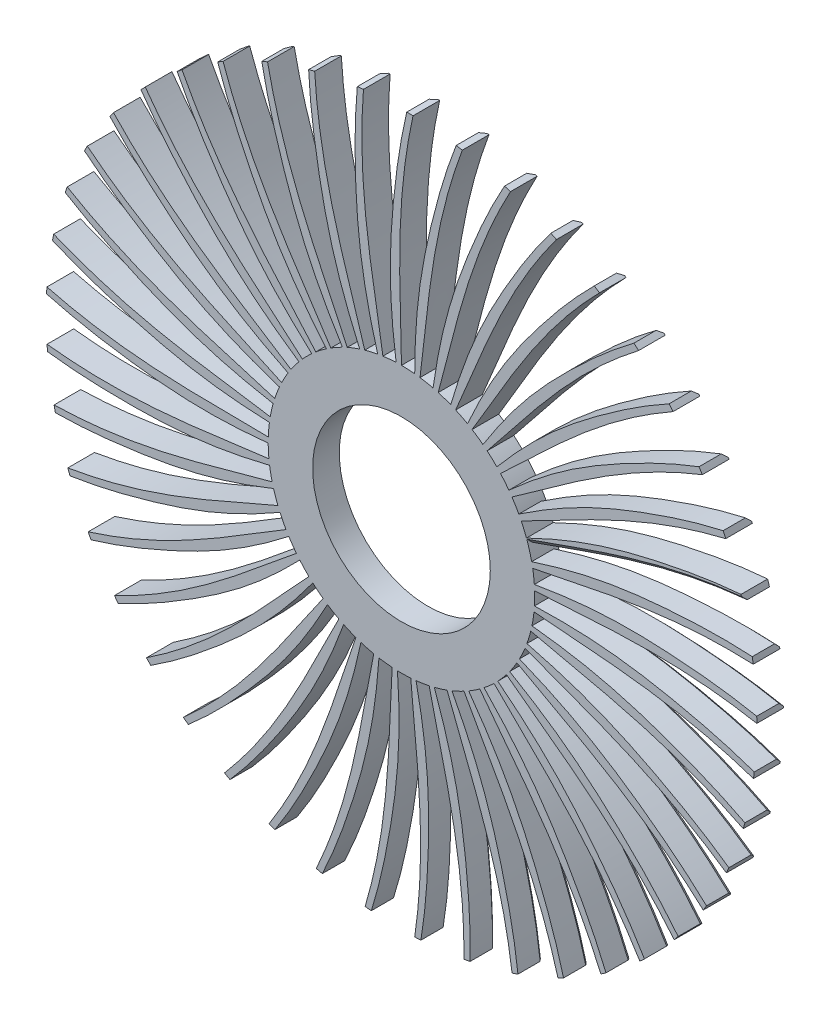
from build123d import *

# Parameters (mm, degrees)
BOSS_EXTRUDE1_DEPTH = 30
CHAMFER1_SIZE       = 5
SKETCH4_R           = 100
CUT_EXTRUDE4_DEPTH  = 30


with BuildPart() as part:
    # Sketch2 → Boss-Extrude1 (new body)
    with BuildSketch(Plane.XY):
        with BuildLine():
            ThreePointArc((13, 399.788694187), (9.500363898, 399.887162942), (6, 399.954997468))
            add(Edge.make_bspline(
                [(-6, 149.879951962), (-14.222349113, 209.385782), (-13.846043503, 280.401880418), (-1.519632424, 368.635153741), (6, 399.954997468)],
                knots=[0, 0, 0, 0, 0.599000586, 1, 1, 1, 1], degree=3))
            ThreePointArc((-6, 149.879951962), (-13.454668429, 149.395354337), (-20.875965144, 148.540210311))
            add(Edge.make_bspline(
                [(-20.875965144, 148.540210311), (-34.199051212, 230.939945753), (-50.019130887, 303.55711138), (-42.766347406, 397.70722841)],
                knots=[0, 0, 0, 0, 1, 1, 1, 1], degree=3))
            ThreePointArc((-42.766347406, 397.70722841), (-46.245629492, 397.317683665), (-49.72136883, 396.897701532))
            add(Edge.make_bspline(
                [(-26.800866099, 147.586291966), (-43.224806767, 205.368685534), (-52.735693973, 275.746031783), (-52.808940935, 364.836129809), (-49.72136883, 396.897701532)],
                knots=[0, 0, 0, 0, 0.599000586, 1, 1, 1, 1], degree=3))
            ThreePointArc((-26.800866099, 147.586291966), (-34.115543253, 146.068921091), (-41.345603373, 144.189254391))
            add(Edge.make_bspline(
                [(-41.345603373, 144.189254391), (-66.006856782, 223.932866069), (-91.779332653, 293.641596886), (-97.700296505, 387.884843817)],
                knots=[0, 0, 0, 0, 1, 1, 1, 1], degree=3))
            ThreePointArc((-97.700296505, 387.884843817), (-101.091504306, 387.014867618), (-104.474967773, 386.1152433))
            add(Edge.make_bspline(
                [(-47.080083824, 142.420032675), (-71.385942725, 197.354321208), (-90.598904145, 265.723100296), (-103.07038348, 353.935985605), (-104.474967773, 386.1152433)],
                knots=[0, 0, 0, 0, 0.599000586, 1, 1, 1, 1], degree=3))
            ThreePointArc((-47.080083824, 142.420032675), (-54.112397833, 139.899422446), (-61.010496461, 137.031818646))
            add(Edge.make_bspline(
                [(-61.010496461, 137.031818646), (-96.529913967, 212.567187867), (-131.753154106, 278.010682721), (-150.732620465, 370.512721951)],
                knots=[0, 0, 0, 0, 1, 1, 1, 1], degree=3))
            ThreePointArc((-150.732620465, 370.512721951), (-153.96974798, 369.179247395), (-157.195080306, 367.817491057))
            add(Edge.make_bspline(
                [(-66.442941271, 134.481729448), (-98.157632508, 185.498679506), (-126.698709702, 250.528170916), (-151.325678251, 336.146880037), (-157.195080306, 367.817491057)],
                knots=[0, 0, 0, 0, 0.599000586, 1, 1, 1, 1], degree=3))
            ThreePointArc((-66.442941271, 134.481729448), (-73.056016141, 131.006940677), (-79.487889635, 127.207214423))
            add(Edge.make_bspline(
                [(-79.487889635, 127.207214423), (-125.174126178, 197.064131145), (-169.162550282, 256.968606849), (-200.831105423, 345.928991405)],
                knots=[0, 0, 0, 0, 1, 1, 1, 1], degree=3))
            ThreePointArc((-200.831105423, 345.928991405), (-203.851145646, 344.157973057), (-206.855569408, 342.360589736))
            add(Edge.make_bspline(
                [(-84.512562444, 123.925892328), (-123.018795627, 170.03251701), (-160.332468993, 230.456995662), (-196.635590825, 311.815057811), (-206.855569408, 342.360589736)],
                knots=[0, 0, 0, 0, 0.599000586, 1, 1, 1, 1], degree=3))
            ThreePointArc((-84.512562444, 123.925892328), (-90.577682196, 119.564557826), (-96.418141453, 114.906666468))
            add(Edge.make_bspline(
                [(-96.418141453, 114.906666468), (-151.381966406, 177.725445267), (-203.279389835, 230.924929343), (-247.020641356, 314.61214653)],
                knots=[0, 0, 0, 0, 1, 1, 1, 1], degree=3))
            ThreePointArc((-247.020641356, 314.61214653), (-249.764812641, 312.438055247), (-252.489850147, 310.240028966))
            add(Edge.make_bspline(
                [(-100.93724272, 110.957978677), (-145.48553782, 151.256864979), (-190.845539151, 205.900237127), (-238.118215294, 281.414110168), (-252.489850147, 310.240028966)],
                knots=[0, 0, 0, 0, 0.599000586, 1, 1, 1, 1], degree=3))
            ThreePointArc((-100.93724272, 110.957978677), (-106.336356696, 105.794986859), (-111.471723822, 100.369590954))
            add(Edge.make_bspline(
                [(-111.471723822, 100.369590954), (-174.643328852, 154.927535756), (-233.439627293, 200.38656076), (-288.402201487, 277.171734088)],
                knots=[0, 0, 0, 0, 1, 1, 1, 1], degree=3))
            ThreePointArc((-288.402201487, 277.171734088), (-290.81709166, 274.636886085), (-293.209703155, 272.080998925))
            add(Edge.make_bspline(
                [(-115.397294381, 95.830394184), (-165.120569508, 129.537170123), (-217.644017972, 177.335864686), (-274.966139557, 245.535756975), (-293.209703155, 272.080998925)],
                knots=[0, 0, 0, 0, 0.599000586, 1, 1, 1, 1], degree=3))
            ThreePointArc((-115.397294381, 95.830394184), (-120.02531497, 89.966236813), (-124.355635883, 83.878935521))
            add(Edge.make_bspline(
                [(-124.355635883, 83.878935521), (-194.505457557, 129.11413799), (-259.056227939, 165.947895708), (-324.170340819, 234.33648912)],
                knots=[0, 0, 0, 0, 1, 1, 1, 1], degree=3))
            ThreePointArc((-324.170340819, 234.33648912), (-326.208946789, 231.49022233), (-328.222562812, 228.626221727))
            add(Edge.make_bspline(
                [(-127.61126897, 78.837580074), (-181.541717132, 105.296181597), (-240.20630355, 145.319851354), (-306.462160683, 204.878329566), (-328.222562812, 228.626221727)],
                knots=[0, 0, 0, 0, 0.599000586, 1, 1, 1, 1], degree=3))
            ThreePointArc((-127.61126897, 78.837580074), (-131.378117014, 72.386396303), (-134.819106945, 65.755672018))
            add(Edge.make_bspline(
                [(-134.819106945, 65.755672018), (-210.581758776, 100.787680393), (-279.63059378, 128.27924363), (-353.628873205, 186.940150946)],
                knots=[0, 0, 0, 0, 1, 1, 1, 1], degree=3))
            ThreePointArc((-353.628873205, 186.940150946), (-355.251515827, 183.837864714), (-356.846943632, 180.721495182))
            add(Edge.make_bspline(
                [(-137.341435363, 60.310282144), (-194.429361732, 79.00572267), (-258.09324666, 110.475352415), (-331.993244448, 160.233178517), (-356.846943632, 180.721495182)],
                knots=[0, 0, 0, 0, 0.599000586, 1, 1, 1, 1], degree=3))
            ThreePointArc((-137.341435363, 60.310282144), (-140.173793452, 53.397636927), (-142.658477444, 46.352549156))
            add(Edge.make_bspline(
                [(-142.658477444, 46.352549156), (-222.559325594, 70.499505241), (-294.762268188, 88.113781989), (-376.204421821, 135.905235374)],
                knots=[0, 0, 0, 0, 1, 1, 1, 1], degree=3))
            ThreePointArc((-376.204421821, 135.905235374), (-377.379518202, 132.607312173), (-378.525704601, 129.2992303))
            add(Edge.make_bspline(
                [(-144.398406941, 40.609113174), (-203.532659967, 51.177507218), (-270.956698301, 73.480576405), (-351.062457345, 112.469270911), (-378.525704601, 129.2992303)],
                knots=[0, 0, 0, 0, 0.599000586, 1, 1, 1, 1], degree=3))
            ThreePointArc((-144.398406941, 40.609113174), (-146.241146445, 33.369553287), (-147.721162952, 26.04722665))
            add(Edge.make_bspline(
                [(-147.721162952, 26.04722665), (-230.205028297, 38.839137412), (-304.156730333, 46.23328581), (-391.457579293, 82.225078986)],
                knots=[0, 0, 0, 0, 1, 1, 1, 1], degree=3))
            ThreePointArc((-391.457579293, 82.225078986), (-392.162257517, 78.79570914), (-392.836893297, 75.360302977))
            add(Edge.make_bspline(
                [(-148.644827779, 20.117534009), (-208.67442649, 22.353179801), (-278.546286018, 35.055584558), (-363.298638838, 62.516276878), (-392.836893297, 75.360302977)],
                knots=[0, 0, 0, 0, 0.599000586, 1, 1, 1, 1], degree=3))
            ThreePointArc((-148.644827779, 20.117534009), (-149.462081869, 12.69196925), (-149.908624053, 5.234924505))
            add(Edge.make_bspline(
                [(-149.908624053, 5.234924505), (-233.370051979, 6.422809952), (-307.631127696, 3.452911312), (-399.09146026, 26.944504965)],
                knots=[0, 0, 0, 0, 1, 1, 1, 1], degree=3))
            ThreePointArc((-399.09146026, 26.944504965), (-399.312004568, 23.450437257), (-399.50195871, 19.954573077))
            add(Edge.make_bspline(
                [(-149.998046125, -0.765610073), (-209.754582665, -6.906226834), (-280.714287119, -4.051724367), (-368.463625573, 11.346474627), (-399.50195871, 19.954573077)],
                knots=[0, 0, 0, 0, 0.599000586, 1, 1, 1, 1], degree=3))
            ThreePointArc((-149.998046125, -0.765610073), (-149.77390788, -8.232649532), (-149.178284305, -15.67926949))
            add(Edge.make_bspline(
                [(-149.178284305, -15.67926949), (-231.992793053, -26.118530198), (-305.117835083, -39.394670176), (-398.957479912, -28.860513196)],
                knots=[0, 0, 0, 0, 1, 1, 1, 1], degree=3))
            ThreePointArc((-398.957479912, -28.860513196), (-398.689597661, -32.351270713), (-398.391172924, -35.83954989))
            add(Edge.make_bspline(
                [(-148.431723123, -21.633852425), (-206.752104481, -36.031211619), (-277.418503929, -43.080171086), (-366.456886956, -40.044173846), (-398.391172924, -35.83954989)],
                knots=[0, 0, 0, 0, 0.599000586, 1, 1, 1, 1], degree=3))
            ThreePointArc((-148.431723123, -21.633852425), (-147.17055514, -28.997029155), (-145.544358941, -36.28828434))
            add(Edge.make_bspline(
                [(-145.544358941, -36.28828434), (-226.100058298, -58.151502867), (-296.665770876, -81.475479221), (-391.058246026, -84.103794296)],
                knots=[0, 0, 0, 0, 1, 1, 1, 1], degree=3))
            ThreePointArc((-391.058246026, -84.103794296), (-390.307151238, -87.523297997), (-389.52615612, -90.936096785))
            add(Edge.make_bspline(
                [(-143.976345469, -42.081016449), (-199.72543176, -64.454889855), (-268.723085119, -81.270111278), (-357.317481874, -90.655408024), (-389.52615612, -90.936096785)],
                knots=[0, 0, 0, 0, 0.599000586, 1, 1, 1, 1], degree=3))
            ThreePointArc((-143.976345469, -42.081016449), (-141.702694948, -49.19701459), (-139.077578185, -56.190989012))
            add(Edge.make_bspline(
                [(-139.077578185, -56.190989012), (-215.806543094, -89.05262268), (-282.439444892, -121.97046074), (-375.547508203, -137.710090707)],
                knots=[0, 0, 0, 0, 1, 1, 1, 1], degree=3))
            ThreePointArc((-375.547508203, -137.710090707), (-374.327820084, -140.991783842), (-373.079455766, -144.262675994))
            add(Edge.make_bspline(
                [(-136.718632022, -61.709121353), (-188.811330695, -91.624026976), (-254.797277125, -117.878221197), (-341.223298449, -139.502137805), (-373.079455766, -144.262675994)],
                knots=[0, 0, 0, 0, 0.599000586, 1, 1, 1, 1], degree=3))
            ThreePointArc((-136.718632022, -61.709121353), (-133.476752983, -68.439436096), (-129.903810568, -75))
            add(Edge.make_bspline(
                [(-129.903810568, -75), (-201.312599004, -118.220434487), (-262.715756383, -160.091425979), (-352.727165312, -188.636016845)],
                knots=[0, 0, 0, 0, 1, 1, 1, 1], degree=3))
            ThreePointArc((-352.727165312, -188.636016845), (-351.062623704, -191.71602499), (-349.371188178, -194.781346312))
            add(Edge.make_bspline(
                [(-126.799845917, -80.136128403), (-174.222231847, -117.009806633), (-235.91212996, -152.191965625), (-318.487591656, -185.633617154), (-349.371188178, -194.781346312)],
                knots=[0, 0, 0, 0, 0.599000586, 1, 1, 1, 1], degree=3))
            ThreePointArc((-126.799845917, -80.136128403), (-122.652837849, -86.349761827), (-118.201613041, -92.349221299))
            add(Edge.make_bspline(
                [(-118.201613041, -92.349221299), (-182.900334165, -145.087220011), (-237.878604511, -195.096393713), (-323.041389369, -235.890357485)],
                knots=[0, 0, 0, 0, 1, 1, 1, 1], degree=3))
            ThreePointArc((-323.041389369, -235.890357485), (-320.964392681, -238.708731786), (-318.862807816, -241.508819284))
            add(Edge.make_bspline(
                [(-114.413045044, -97.003376868), (-156.242095431, -140.118123501), (-212.435221531, -183.543466558), (-289.552886165, -228.151949301), (-318.862807816, -241.508819284)],
                knots=[0, 0, 0, 0, 0.599000586, 1, 1, 1, 1], degree=3))
            ThreePointArc((-114.413045044, -97.003376868), (-109.441624742, -102.579387666), (-104.198755569, -107.900970051))
            add(Edge.make_bspline(
                [(-104.198755569, -107.900970051), (-160.928122367, -169.130047832), (-208.411416185, -226.304032063), (-287.067980236, -278.553360639)],
                knots=[0, 0, 0, 0, 1, 1, 1, 1], degree=3))
            ThreePointArc((-287.067980236, -278.553360639), (-284.618954846, -281.055244645), (-282.1481256, -283.535597801))
            add(Edge.make_bspline(
                [(-99.799324392, -111.982564942), (-135.22088435, -160.499200477), (-184.823503156, -211.322502692), (-254.982363107, -266.229563273), (-282.1481256, -283.535597801)],
                knots=[0, 0, 0, 0, 0.599000586, 1, 1, 1, 1], degree=3))
            ThreePointArc((-99.799324392, -111.982564942), (-94.100254897, -116.812422406), (-88.167787844, -121.352549156))
            add(Edge.make_bspline(
                [(-88.167787844, -121.352549156), (-135.82362772, -189.880951654), (-174.887736707, -253.106919845), (-245.507119403, -315.794639477)],
                knots=[0, 0, 0, 0, 1, 1, 1, 1], degree=3))
            ThreePointArc((-245.507119403, -315.794639477), (-242.733732804, -317.931336862), (-239.941751059, -320.043678424))
            add(Edge.make_bspline(
                [(-83.243123411, -124.782139767), (-111.567752567, -177.75634308), (-153.614405526, -234.988386687), (-215.448898389, -299.125321628), (-239.941751059, -320.043678424)],
                knots=[0, 0, 0, 0, 0.599000586, 1, 1, 1, 1], degree=3))
            ThreePointArc((-83.243123411, -124.782139767), (-76.927330628, -128.771836216), (-70.420734418, -132.442138929))
            add(Edge.make_bspline(
                [(-70.420734418, -132.442138929), (-108.075480657, -206.936038739), (-137.960066366, -274.983369337), (-199.167741751, -346.889334869)],
                knots=[0, 0, 0, 0, 1, 1, 1, 1], degree=3))
            ThreePointArc((-199.167741751, -346.889334869), (-196.123974759, -348.619257249), (-193.065183262, -350.32247289))
            add(Edge.make_bspline(
                [(-65.066689721, -135.152972179), (-85.743081387, -191.55366066), (-119.415378226, -254.080489031), (-171.721965934, -326.198945848), (-193.065183262, -350.32247289)],
                knots=[0, 0, 0, 0, 0.599000586, 1, 1, 1, 1], degree=3))
            ThreePointArc((-65.066689721, -135.152972179), (-58.257103372, -138.22485271), (-51.303021499, -140.953893118))
            add(Edge.make_bspline(
                [(-51.303021499, -140.953893118), (-78.223767297, -219.963351216), (-98.347160261, -291.507580335), (-148.951790556, -371.232223938)],
                knots=[0, 0, 0, 0, 1, 1, 1, 1], degree=3))
            ThreePointArc((-148.951790556, -371.232223938), (-145.696886633, -372.521700342), (-142.430821282, -373.782638908))
            add(Edge.make_bspline(
                [(-45.623806927, -142.893205722), (-58.249518658, -201.622604125), (-82.892066422, -268.227203667), (-124.652660742, -346.923478632), (-142.430821282, -373.782638908)],
                knots=[0, 0, 0, 0, 0.599000586, 1, 1, 1, 1], degree=3))
            ThreePointArc((-45.623806927, -142.893205722), (-38.452967865, -144.987479675), (-31.186753623, -146.72214011))
            add(Edge.make_bspline(
                [(-31.186753623, -146.72214011), (-46.849517285, -228.709327266), (-56.820038549, -302.357927866), (-95.836662188, -388.349500039)],
                knots=[0, 0, 0, 0, 1, 1, 1, 1], degree=3))
            ThreePointArc((-95.836662188, -388.349500039), (-92.433974336, -389.173432275), (-89.024205379, -389.96755103))
            add(Edge.make_bspline(
                [(-25.292908628, -147.852185554), (-29.622195307, -207.767192943), (-44.755354834, -277.153180889), (-75.1571333, -360.895540525), (-89.024205379, -389.96755103)],
                knots=[0, 0, 0, 0, 0.599000586, 1, 1, 1, 1], degree=3))
            ThreePointArc((-25.292908628, -147.852185554), (-17.900389078, -148.928090268), (-10.463471062, -149.634607539))
            add(Edge.make_bspline(
                [(-10.463471062, -149.634607539), (-14.563394709, -233.003736414), (-14.186979419, -307.323222258), (-40.856182202, -397.907994863)],
                knots=[0, 0, 0, 0, 1, 1, 1, 1], degree=3))
            ThreePointArc((-40.856182202, -397.907994863), (-37.371939871, -398.250346027), (-33.884834581, -398.562188354))
            add(Edge.make_bspline(
                [(-4.469712632, -149.933390774), (-0.418309619, -209.867829681), (-5.747531172, -280.684686701), (-24.198757747, -367.843181234), (-33.884834581, -398.562188354)],
                knots=[0, 0, 0, 0, 0.599000586, 1, 1, 1, 1], degree=3))
            ThreePointArc((-4.469712632, -149.933390774), (3.00060042, -149.969984987), (10.463471062, -149.634607539))
            add(Edge.make_bspline(
                [(10.463471062, -149.634607539), (18.006187779, -232.76299287), (28.722213128, -306.306819704), (14.919516896, -399.72166318)],
                knots=[0, 0, 0, 0, 1, 1, 1, 1], degree=3))
            ThreePointArc((14.919516896, -399.72166318), (18.417496894, -399.575769796), (21.914065978, -399.399266039))
            add(Edge.make_bspline(
                [(16.440481235, -149.096313089), (28.79371799, -207.883627836), (33.372161647, -278.752984361), (27.230619099, -367.631172835), (21.914065978, -399.399266039)],
                knots=[0, 0, 0, 0, 0.599000586, 1, 1, 1, 1], degree=3))
            ThreePointArc((16.440481235, -149.096313089), (23.843186645, -148.092884537), (31.186753623, -146.72214011))
            add(Edge.make_bspline(
                [(31.186753623, -146.72214011), (50.225300304, -227.991782434), (71.072360468, -299.328503323), (70.404824569, -393.755204)],
                knots=[0, 0, 0, 0, 1, 1, 1, 1], degree=3))
            ThreePointArc((70.404824569, -393.755204), (73.848458031, -393.123905717), (77.286434171, -392.46249132))
            add(Edge.make_bspline(
                [(37.030679836, -145.357245264), (57.445308631, -201.85320764), (71.842303299, -271.395672257), (78.129982919, -360.263641831), (77.286434171, -392.46249132)],
                knots=[0, 0, 0, 0, 0.599000586, 1, 1, 1, 1], degree=3))
            ThreePointArc((37.030679836, -145.357245264), (44.221692363, -143.333324543), (51.303021499, -140.953893118))
            add(Edge.make_bspline(
                [(51.303021499, -140.953893118), (81.466834489, -218.78297129), (112.039165155, -286.524098106), (124.519782416, -380.124747665)],
                knots=[0, 0, 0, 0, 1, 1, 1, 1], degree=3))
            ThreePointArc((124.519782416, -380.124747665), (127.842042934, -379.020331986), (131.154509834, -377.886880627))
            add(Edge.make_bspline(
                [(56.900118376, -138.788964002), (84.978791682, -191.893944361), (108.914116237, -258.7559521), (127.508635493, -345.883988833), (131.154509834, -377.886880627)],
                knots=[0, 0, 0, 0, 0.599000586, 1, 1, 1, 1], degree=3))
            ThreePointArc((56.900118376, -138.788964002), (63.73947314, -135.783944426), (70.420734418, -132.442138929))
            add(Edge.make_bspline(
                [(70.420734418, -132.442138929), (111.122709408, -205.315798472), (150.825254934, -268.142827236), (176.211104337, -359.095595501)],
                knots=[0, 0, 0, 0, 1, 1, 1, 1], degree=3))
            ThreePointArc((176.211104337, -359.095595501), (179.34732789, -357.539558621), (182.469812149, -355.956131643))
            add(Edge.make_bspline(
                [(75.662060835, -129.519313426), (110.858259215, -178.199683731), (143.86603979, -241.079841667), (174.405477516, -324.77209743), (182.469812149, -355.956131643)],
                knots=[0, 0, 0, 0, 0.599000586, 1, 1, 1, 1], degree=3))
            ThreePointArc((75.662060835, -129.519313426), (82.016637575, -125.591684282), (88.167787844, -121.352549156))
            add(Edge.make_bspline(
                [(88.167787844, -121.352549156), (138.615707188, -187.852387179), (186.675702688, -244.542461241), (224.47267755, -331.077056036)],
                knots=[0, 0, 0, 0, 1, 1, 1, 1], degree=3))
            ThreePointArc((224.47267755, -331.077056036), (227.361821112, -329.099684443), (230.233547127, -327.097101451))
            add(Edge.make_bspline(
                [(92.951327344, -117.728716739), (134.579996832, -161.036968957), (176.017774524, -218.711386339), (217.907715302, -297.338886573), (230.233547127, -327.097101451)],
                knots=[0, 0, 0, 0, 0.599000586, 1, 1, 1, 1], degree=3))
            ThreePointArc((92.951327344, -117.728716739), (98.697441453, -112.954924862), (104.198755569, -107.900970051))
            add(Edge.make_bspline(
                [(104.198755569, -107.900970051), (163.410707901, -166.73264285), (218.892720229, -216.182354402), (268.365145428, -296.61447827)],
                knots=[0, 0, 0, 0, 1, 1, 1, 1], degree=3))
            ThreePointArc((268.365145428, -296.61447827), (270.950975107, -294.254259253), (273.516047997, -291.871498246))
            add(Edge.make_bspline(
                [(108.431401996, -103.646664496), (155.682287893, -140.739852759), (204.743523494, -192.085962657), (257.168627276, -264.118312507), (273.516047997, -291.871498246)],
                knots=[0, 0, 0, 0, 0.599000586, 1, 1, 1, 1], degree=3))
            ThreePointArc((108.431401996, -103.646664496), (113.457211899, -98.119626314), (118.201613041, -92.349221299))
            add(Edge.make_bspline(
                [(118.201613041, -92.349221299), (185.025105061, -142.367637282), (246.849239958, -183.614503938), (307.034191011, -256.378637079)],
                knots=[0, 0, 0, 0, 1, 1, 1, 1], degree=3))
            ThreePointArc((307.034191011, -256.378637079), (309.266376574, -253.681509615), (311.474870112, -250.964948327))
            add(Edge.make_bspline(
                [(121.800982748, -87.547247825), (173.754400306, -117.703395416), (229.484172672, -161.721804207), (291.424044446, -225.756975918), (311.474870112, -250.964948327)],
                knots=[0, 0, 0, 0, 0.599000586, 1, 1, 1, 1], degree=3))
            ThreePointArc((121.800982748, -87.547247825), (126.008666771, -81.37454085), (129.903810568, -75))
            add(Edge.make_bspline(
                [(129.903810568, -75), (203.038199014, -115.231607596), (270.001120017, -147.472806013), (339.727165312, -211.152677343)],
                knots=[0, 0, 0, 0, 1, 1, 1, 1], degree=3))
            ThreePointArc((339.727165312, -211.152677343), (341.562259806, -208.171137952), (343.371188178, -205.173651157))
            add(Edge.make_bspline(
                [(132.799845917, -69.743823558), (188.44458096, -92.375975367), (249.758173463, -128.209914793), (320.00722408, -183.001536587), (343.371188178, -205.173651157)],
                knots=[0, 0, 0, 0, 0.599000586, 1, 1, 1, 1], degree=3))
            ThreePointArc((132.799845917, -69.743823558), (136.107506278, -63.04559251), (139.077578185, -56.190989012))
            add(Edge.make_bspline(
                [(139.077578185, -56.190989012), (217.099385377, -85.852725742), (287.897735398, -108.460717667), (365.807736774, -161.816870925)],
                knots=[0, 0, 0, 0, 1, 1, 1, 1], degree=3))
            ThreePointArc((365.807736774, -161.816870925), (367.210022172, -158.608951879), (368.584176646, -155.388882249))
            add(Edge.make_bspline(
                [(141.213911143, -50.582915098), (199.466902198, -65.250562033), (265.170915503, -92.202565225), (342.3618271, -136.684180508), (368.584176646, -155.388882249)],
                knots=[0, 0, 0, 0, 0.599000586, 1, 1, 1, 1], degree=3))
            ThreePointArc((141.213911143, -50.582915098), (143.557167994, -43.489533425), (145.544358941, -36.28828434))
            add(Edge.make_bspline(
                [(145.544358941, -36.28828434), (226.934979149, -54.802818237), (300.190748837, -67.337564823), (384.768276741, -109.331483179)],
                knots=[0, 0, 0, 0, 1, 1, 1, 1], degree=3))
            ThreePointArc((384.768276741, -109.331483179), (385.710459152, -105.959622973), (386.623093373, -102.5796455))
            add(Edge.make_bspline(
                [(146.879408216, -30.437467733), (206.606827075, -36.855120731), (275.422407301, -54.400597603), (358.052746587, -87.706422331), (386.623093373, -102.5796455)],
                knots=[0, 0, 0, 0, 0.599000586, 1, 1, 1, 1], degree=3))
            ThreePointArc((146.879408216, -30.437467733), (148.21265273, -23.08700004), (149.178284305, -15.67926949))
            add(Edge.make_bspline(
                [(149.178284305, -15.67926949), (232.353541687, -22.686236213), (306.640890813, -24.903762876), (396.239739868, -54.718082475)],
                knots=[0, 0, 0, 0, 1, 1, 1, 1], degree=3))
            ThreePointArc((396.239739868, -54.718082475), (396.703480784, -51.247910533), (397.136831365, -47.773812634))
            add(Edge.make_bspline(
                [(149.686064682, -9.699589681), (209.725385075, -7.742336426), (280.313115228, -15.539784229), (366.77457664, -37.021558408), (397.136831365, -47.773812634)],
                knots=[0, 0, 0, 0, 0.599000586, 1, 1, 1, 1], degree=3))
            ThreePointArc((149.686064682, -9.699589681), (149.983346769, -2.235104461), (149.908624053, 5.234924505))
            add(Edge.make_bspline(
                [(149.908624053, 5.234924505), (233.249606835, 9.871907594), (307.122616647, 18.014762488), (399.998847174, 0.960343463)],
                knots=[0, 0, 0, 0, 1, 1, 1, 1], degree=3))
            ThreePointArc((399.998847174, 0.960343463), (399.975120405, 4.461284192), (399.920752671, 7.961883153))
            add(Edge.make_bspline(
                [(149.579252164, 11.227079851), (208.761877013, 21.521143651), (279.74784722, 23.623493369), (368.357556759, 14.383888037), (399.920752671, 7.961883153)],
                knots=[0, 0, 0, 0, 0.599000586, 1, 1, 1, 1], degree=3))
            ThreePointArc((149.579252164, 11.227079851), (148.834785567, 18.660294884), (147.721162952, 26.04722665))
            add(Edge.make_bspline(
                [(147.721162952, 26.04722665), (229.605733703, 42.237905949), (301.626550096, 60.582650991), (395.972431912, 56.620077408)],
                knots=[0, 0, 0, 0, 1, 1, 1, 1], degree=3))
            ThreePointArc((395.972431912, 56.620077408), (395.461699273, 60.083645094), (394.920671429, 63.542609941))
            add(Edge.make_bspline(
                [(146.561049647, 31.935227045), (203.735056479, 50.365739146), (273.737605573, 62.32696654), (362.770876036, 65.509368464), (394.920671429, 63.542609941)],
                knots=[0, 0, 0, 0, 0.599000586, 1, 1, 1, 1], degree=3))
            ThreePointArc((146.561049647, 31.935227045), (144.789324561, 39.192492815), (142.658477444, 46.352549156))
            add(Edge.make_bspline(
                [(142.658477444, 46.352549156), (221.492846137, 73.781791509), (290.259665842, 101.971367105), (384.238863675, 111.177765951)],
                knots=[0, 0, 0, 0, 1, 1, 1, 1], degree=3))
            ThreePointArc((384.238863675, 111.177765951), (383.251065996, 114.536546189), (382.233908533, 117.886552105))
            add(Edge.make_bspline(
                [(140.690203009, 52.02179137), (194.742764815, 78.230022819), (262.399372806, 99.817316203), (350.123272857, 115.359783549), (382.233908533, 117.886552105)],
                knots=[0, 0, 0, 0, 0.599000586, 1, 1, 1, 1], degree=3))
            ThreePointArc((140.690203009, 52.02179137), (137.925704048, 58.961853455), (134.819106945, 65.755672018))
            add(Edge.make_bspline(
                [(134.819106945, 65.755672018), (209.068852265, 103.889598424), (273.243207358, 141.375326549), (365.026523021, 163.571505742)],
                knots=[0, 0, 0, 0, 1, 1, 1, 1], degree=3))
            ThreePointArc((365.026523021, 163.571505742), (363.580886661, 166.760123696), (362.107397393, 169.935966627))
            add(Edge.make_bspline(
                [(132.080981602, 71.0958107), (181.960026751, 104.571648084), (245.953834722, 135.364835347), (330.660918431, 162.964851668), (362.107397393, 169.935966627)],
                knots=[0, 0, 0, 0, 0.599000586, 1, 1, 1, 1], degree=3))
            ThreePointArc((132.080981602, 71.0958107), (128.377516594, 77.583588684), (124.355635883, 83.878935521))
            add(Edge.make_bspline(
                [(124.355635883, 83.878935521), (192.575570997, 131.975312477), (250.908380652, 178.027576074), (338.709356309, 212.781512234)],
                knots=[0, 0, 0, 0, 1, 1, 1, 1], degree=3))
            ThreePointArc((338.709356309, 212.781512234), (336.834018933, 215.737905082), (334.932877653, 218.677770857))
            add(Edge.make_bspline(
                [(120.900954128, 88.786030945), (165.635643742, 128.877905167), (224.721085014, 168.277631945), (304.762625349, 207.397994318), (334.932877653, 218.677770857)],
                knots=[0, 0, 0, 0, 0.599000586, 1, 1, 1, 1], degree=3))
            ThreePointArc((120.900954128, 88.786030945), (116.330606807, 94.69524761), (111.471723822, 100.369590954))
            add(Edge.make_bspline(
                [(111.471723822, 100.369590954), (172.33402529, 157.492277193), (223.68990772, 211.214721333), (305.799597252, 257.849968626)],
                knots=[0, 0, 0, 0, 1, 1, 1, 1], degree=3))
            ThreePointArc((305.799597252, 257.849968626), (303.531060171, 260.516593544), (301.239270431, 263.16326102))
            add(Edge.make_bspline(
                [(107.367727105, 104.74813209), (146.087351336, 150.675700422), (199.114395002, 197.915095852), (272.932474426, 247.794370921), (301.239270431, 263.16326102)],
                knots=[0, 0, 0, 0, 0.599000586, 1, 1, 1, 1], degree=3))
            ThreePointArc((107.367727105, 104.74813209), (102.019454082, 109.963771256), (96.418141453, 114.906666468))
            add(Edge.make_bspline(
                [(96.418141453, 114.906666468), (148.738193808, 179.943833878), (192.117565179, 240.290812295), (266.937796877, 297.899668678)],
                knots=[0, 0, 0, 0, 1, 1, 1, 1], degree=3))
            ThreePointArc((266.937796877, 297.899668678), (264.320214583, 300.224622845), (261.682383464, 302.52657765))
            add(Edge.make_bspline(
                [(91.744709403, 118.671429993), (123.695634808, 169.54076456), (169.632169781, 223.700367542), (235.790003346, 283.367711955), (261.682383464, 302.52657765)],
                knots=[0, 0, 0, 0, 0.599000586, 1, 1, 1, 1], degree=3))
            ThreePointArc((91.744709403, 118.671429993), (85.722608729, 123.091975176), (79.487889635, 127.207214423))
            add(Edge.make_bspline(
                [(79.487889635, 127.207214423), (122.247342571, 198.89298852), (156.805872762, 264.689915923), (222.880355922, 332.151090535)],
                knots=[0, 0, 0, 0, 1, 1, 1, 1], degree=3))
            ThreePointArc((222.880355922, 332.151090535), (219.964676679, 334.089121364), (217.032146562, 336.001558566))
            add(Edge.make_bspline(
                [(74.33598529, 130.284923498), (98.89632345, 185.105910565), (136.848247329, 245.131566033), (194.058148057, 313.425622803), (217.032146562, 336.001558566)],
                knots=[0, 0, 0, 0, 0.599000586, 1, 1, 1, 1], degree=3))
            ThreePointArc((74.33598529, 130.284923498), (67.757270305, 133.824333814), (61.010496461, 137.031818646))
            add(Edge.make_bspline(
                [(61.010496461, 137.031818646), (93.377085865, 213.970917378), (118.442132395, 283.937131417), (174.484802363, 359.937569232)],
                knots=[0, 0, 0, 0, 1, 1, 1, 1], degree=3))
            ThreePointArc((174.484802363, 359.937569232), (171.327776549, 361.450955155), (168.157625798, 362.93665134))
            add(Edge.make_bspline(
                [(55.480395779, 139.362569165), (72.172107649, 197.068180576), (101.400729405, 261.791557425), (148.549171654, 337.383060419), (168.157625798, 362.93665134)],
                knots=[0, 0, 0, 0, 0.599000586, 1, 1, 1, 1], degree=3))
            ThreePointArc((55.480395779, 139.362569165), (48.473113687, 141.951954018), (41.345603373, 144.189254391))
            add(Edge.make_bspline(
                [(41.345603373, 144.189254391), (62.689350398, 224.884145717), (77.773050648, 297.657833622), (122.693100598, 380.718272566)],
                knots=[0, 0, 0, 0, 1, 1, 1, 1], degree=3))
            ThreePointArc((122.693100598, 380.718272566), (119.356176131, 381.777557249), (116.010108124, 382.807595031))
            add(Edge.make_bspline(
                [(35.544943473, 145.727680945), (44.043143868, 205.194742614), (63.979561624, 273.356073935), (100.148854597, 354.773720531), (116.010108124, 382.807595031)],
                knots=[0, 0, 0, 0, 0.599000586, 1, 1, 1, 1], degree=3))
            ThreePointArc((35.544943473, 145.727680945), (28.245483049, 147.316640904), (20.875965144, 148.540210311))
            add(Edge.make_bspline(
                [(20.875965144, 148.540210311), (30.781438033, 231.420259962), (35.590204935, 305.584964677), (68.513317192, 394.088727785)],
                knots=[0, 0, 0, 0, 1, 1, 1, 1], degree=3))
            ThreePointArc((68.513317192, 394.088727785), (65.06144351, 394.673293457), (61.604585655, 395.227624321))
            add(Edge.make_bspline(
                [(14.917649274, 149.256369178), (15.056930389, 209.327422392), (25.313104453, 279.600025404), (49.799254003, 365.259113722), (61.604585655, 395.227624321)],
                knots=[0, 0, 0, 0, 0.599000586, 1, 1, 1, 1], degree=3))
            ThreePointArc((14.917649274, 149.256369178), (7.468086212, 149.813976946), (0, 150))
            add(Edge.make_bspline(
                [(0, 150), (-1.72560001, 233.452042083), (-7.285363634, 307.564231992), (13, 399.788694187)],
                knots=[0, 0, 0, 0, 1, 1, 1, 1], degree=3))
        make_face()
    extrude(amount=BOSS_EXTRUDE1_DEPTH)

    # Chamfer1
    chamfer1_edges = [part.edges().sort_by_distance(p)[0] for p in [
        (64.919210772, 267.911049319, 0),
        (27.00140996, 274.338765278, 0),
        (-11.441942582, 275.426789228, 0),
        (-49.662590728, 271.153944018, 0),
        (-86.916613036, 261.603395721, 0),
        (-122.478902336, 246.961034896, 0),
        (-155.657279121, 227.51185844, 0),
        (-185.805964025, 203.634422451, 0),
        (-212.338147191, 175.79347406, 0),
        (-234.737409852, 144.530905658, 0),
        (-252.567775841, 110.455207579, 0),
        (-265.482197364, 74.229624525, 0),
        (-273.229309897, 36.559246265, 0),
        (-275.658324707, -1.822716138, 0),
        (-272.721963783, -40.169201445, 0),
        (-264.477380051, -77.733838937, 0),
        (-251.085044954, -113.785475675, 0),
        (-232.805625063, -147.622407559, 0),
        (-209.994908492, -178.586037197, 0),
        (-183.096879893, -206.07369276, 0),
        (-152.635078796, -229.550358299, 0),
        (-119.202409511, -248.559087223, 0),
        (-83.449600915, -262.729896246, 0),
        (-46.07254076, -271.786966689, 0),
        (-7.798731006, -275.554012979, 0),
        (30.626872177, -273.957713845, 0),
        (68.45635813, -267.029139432, 0),
        (104.95341894, -254.903146562, 0),
        (139.407680833, -237.815753892, 0),
        (171.148530792, -216.099548084, 0),
        (199.558169278, -190.177210382, 0),
        (224.083634994, -160.553289603, 0),
        (244.247567645, -127.804381669, 0),
        (259.65749922, -92.567906821, 0),
        (270.013492928, -55.529702961, 0),
        (275.113981133, -17.410676597, 0),
        (274.859688632, 21.047228783, 0),
        (269.25556494, 59.095473795, 0),
        (261.41669785, 86.683401412, 30),
        (242.536140858, 131.023107321, 0),
        (221.940903664, 163.502506266, 0),
        (197.025839234, 192.799514907, 0),
        (168.275890958, 218.343900297, 0),
        (136.250643874, 239.63847003, 0),
        (101.573432991, 256.268749528, 0),
    ]]
    chamfer(chamfer1_edges, length=CHAMFER1_SIZE)

    # Sketch4 → Cut-Extrude4 (cut)
    with BuildSketch(Plane.XY.offset(30)):
        Circle(SKETCH4_R)
    extrude(amount=-CUT_EXTRUDE4_DEPTH, mode=Mode.SUBTRACT)


solid = part.part
